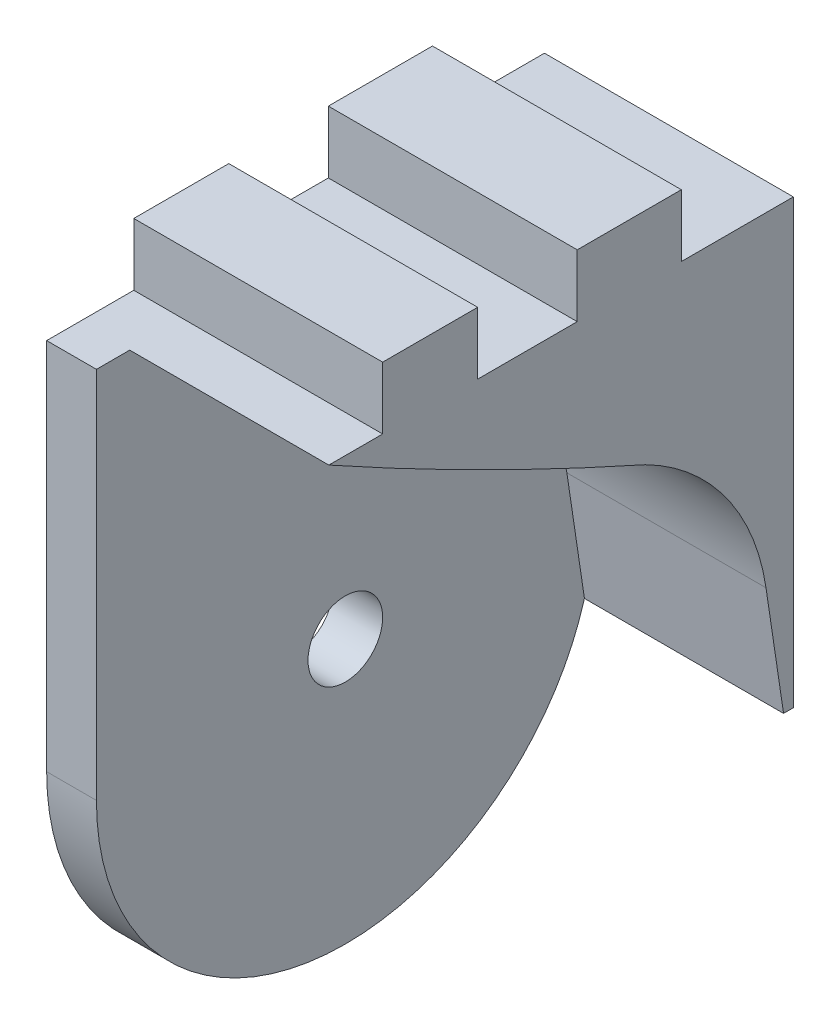
from build123d import *

# Parameters (mm, degrees)
DODANIE_WYCI_GNI_CIE1_DEPTH = 40
ZAOKR_GLENIE1_R             = 20
DODANIE_WYCI_GNI_CIE2_DEPTH = 20
SZKIC6_R                    = 3
WYTNIJ_WYCI_GNI_CIE1_DEPTH  = 10
WYTNIJ_WYCI_GNI_CIE2_DEPTH  = 71.887234394


with BuildPart() as part:
    # Szkic1 → Dodanie-wyciągnięcie1 (new body)
    with BuildSketch(Plane.XY):
        Polygon((0, 0), (-4, 0), (-4, 55), (16, 55), (16, 51.5), (0, 51.5), align=None)
    extrude(amount=DODANIE_WYCI_GNI_CIE1_DEPTH)

    # Zaokrąglenie1
    zaokr_glenie1_edges = [part.edges().sort_by_distance(p)[0] for p in [
        (-2, 0, 0),
        (-2, 0, 40),
    ]]
    fillet(zaokr_glenie1_edges, radius=ZAOKR_GLENIE1_R - 0.0001)  # a hair under: the kernel refuses the full size

    # Szkic5 → Dodanie-wyciągnięcie2 (add)
    with BuildSketch(Plane.ZY.offset(4)):
        with BuildLine():
            ThreePointArc((0.786266298, 14.447303609), (0.197542147, 17.19595596), (0, 20))
            Line((0, 20), (0, 14.447303609))
            Line((0, 14.447303609), (0.786266298, 14.447303609))
        make_face()
        with BuildLine():
            Line((40, 51.5), (0, 51.5))
            Line((0, 51.5), (0, 20))
            ThreePointArc((0, 20), (0.197542147, 17.19595596), (0.786266298, 14.447303609))
            Line((0.786266298, 14.447303609), (2.19744111, 23.896337815))
            ThreePointArc((2.19744111, 23.896337815), (5.410467594, 31.78015679), (11.887142793, 37.30562683))
            Line((11.887142793, 37.30562683), (40, 51.5))
        make_face()
        with BuildLine():
            ThreePointArc((40, 51.5), (26.114639544, 44.064002088), (11.887142793, 37.30562683))
            Line((11.887142793, 37.30562683), (40, 51.5))
        make_face()
    extrude(amount=-DODANIE_WYCI_GNI_CIE2_DEPTH)

    # Szkic6 → Wytnij-wyciągnięcie1 (cut)
    with BuildSketch(Plane.ZY.offset(4)):
        with Locations((20, 21.237598079)):
            Circle(SZKIC6_R)
    extrude(amount=-WYTNIJ_WYCI_GNI_CIE1_DEPTH, mode=Mode.SUBTRACT)

    # Szkic8 → Wytnij-wyciągnięcie2 (cut, through all)
    with BuildSketch(Plane.ZY.offset(4)):
        Polygon((0, 50), (9, 50), (9, 55), (17.366037593, 55), (17.366037593, 50), (25.366037593, 50), (25.366037593, 55), (33, 55), (33, 50), (40, 50), (40, 57.074314744), (0, 57.074314744), align=None)
    extrude(amount=-WYTNIJ_WYCI_GNI_CIE2_DEPTH, mode=Mode.SUBTRACT)


solid = part.part
